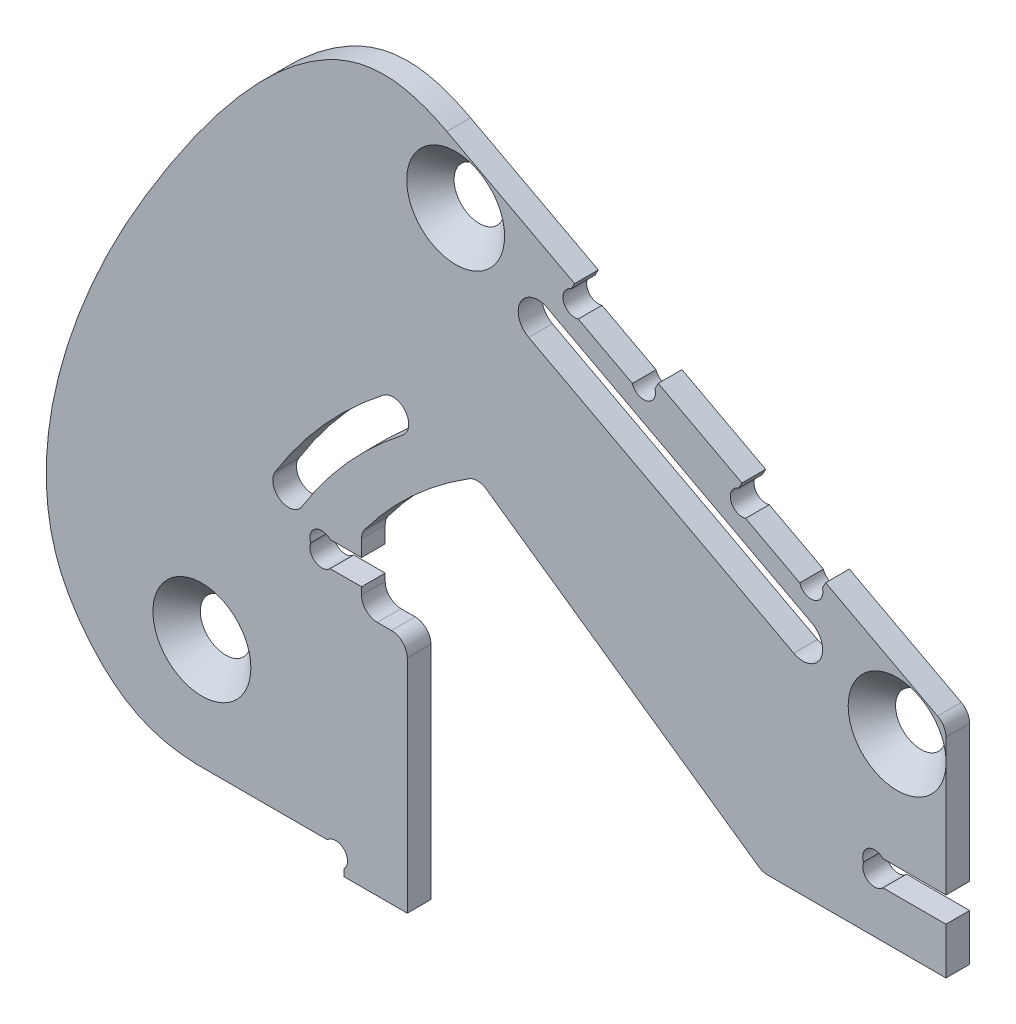
from build123d import *

# Parameters (mm, degrees)
BASE_DEPTH                        = 1.5
CAMERA_CUT_REACH                  = 81.23
TOP_COVER_SOCKETS_REACH           = 81.23
SKETCH4_W                         = 5
SKETCH4_H                         = 1.5
STANDOFF_HOLE_REACH               = 62.831
SKETCH5_R                         = 1.6
GOPRO_MOUNT_HOLDERS_REACH         = 62.831
CAMERA_ANGLE_ADJUSTMENT_CUT_REACH = 62.831
FILLET6_R                         = 1
MILLING_START                     = -1.5
SKETCH10_R                        = 0.75
MILLING_HOLES_DEPTH               = 1.5
GOPRO_STRAP_REACH                 = 62.831
CHAMFER1_SIZE                     = 1.5
FRONT_CURVE_REACH                 = 62.831
FILLET7_R                         = 1


with BuildPart() as part:
    # Sketch1 → Base (new body)
    with BuildSketch(Plane.XY):
        Polygon((2.5, 0), (0, 0), (-1.5, 0), (-1.5, -1.5), (2.5, -1.5), align=None)
        Polygon((-1.5, 0), (0, 0), (2.5, 0), (2.5, 12), (62.584278166, 12), (-6.179064047, 48.562117607), (-32, 0), align=None)
    extrude(amount=BASE_DEPTH)

    # Sketch3 → Camera cut (cut, up to next)
    with BuildSketch(Plane.XY.offset(1.5), mode=Mode.PRIVATE) as camera_cut_sk1:
        with BuildLine():
            Line((2.5, 12), (25, 12))
            Line((25, 12), (6.978655026, 24.6186816))
            ThreePointArc((6.978655026, 24.6186816), (2.93893247, 21.650461355), (-0.396076952, 17.907814978))
            Line((-0.396076952, 17.907814978), (-0.396076952, 13.5))
            Line((-0.396076952, 13.5), (2.5, 13.5))
            Line((2.5, 13.5), (2.5, 12))
        make_face()
    camera_cut_tool1 = extrude(camera_cut_sk1.sketch, amount=-CAMERA_CUT_REACH, mode=Mode.PRIVATE) & part.part
    add(camera_cut_tool1.solids().sort_by_distance((9.594765, 16.626253, 1.5))[0], mode=Mode.SUBTRACT)

    # Sketch4 → Top cover sockets (cut, up to next)
    with BuildSketch(Plane.XY.offset(1.5), mode=Mode.PRIVATE) as top_cover_sockets_sk1:
        Polygon((36.603923048, 16.5), (36.603923048, 15), (36.603923048, 14.95), (36.603923048, 12), (62.584278166, 12), (36.603923048, 25.813999854), (36.603923048, 16.55), align=None)
    top_cover_sockets_tool1 = extrude(top_cover_sockets_sk1.sketch, amount=-TOP_COVER_SOCKETS_REACH, mode=Mode.PRIVATE) & part.part
    # Sketch4 → Top cover sockets (cut, up to next)
    with BuildSketch(Plane.XY.offset(1.5), mode=Mode.PRIVATE) as top_cover_sockets_sk2:
        with Locations((34.103923048, 15.75)):
            Rectangle(SKETCH4_W, SKETCH4_H)
    top_cover_sockets_tool2 = extrude(top_cover_sockets_sk2.sketch, amount=-TOP_COVER_SOCKETS_REACH, mode=Mode.PRIVATE) & part.part
    # Sketch4 → Top cover sockets (cut, up to next)
    with BuildSketch(Plane.XY.offset(1.5), mode=Mode.PRIVATE) as top_cover_sockets_sk3:
        Polygon((36.603923048, 14.95), (36.603923048, 15), (31.603923048, 15), (31.603923048, 16.5), (36.603923048, 16.5), (36.603923048, 16.55), (31.553923048, 16.55), (31.553923048, 14.95), align=None)
    top_cover_sockets_tool3 = extrude(top_cover_sockets_sk3.sketch, amount=-TOP_COVER_SOCKETS_REACH, mode=Mode.PRIVATE) & part.part
    # Sketch4 → Top cover sockets (cut, up to next)
    with BuildSketch(Plane.XY.offset(1.5), mode=Mode.PRIVATE) as top_cover_sockets_sk4:
        Polygon((-0.396076952, 16.55), (-3.446076952, 16.55), (-3.446076952, 14.95), (-0.396076952, 14.95), (-0.396076952, 15), (-3.396076952, 15), (-3.396076952, 16.5), (-0.396076952, 16.5), align=None)
    top_cover_sockets_tool4 = extrude(top_cover_sockets_sk4.sketch, amount=-TOP_COVER_SOCKETS_REACH, mode=Mode.PRIVATE) & part.part
    add(top_cover_sockets_tool1.solids().sort_by_distance((45.264041, 16.604667, 1.5))[0], mode=Mode.SUBTRACT)
    add(top_cover_sockets_tool2.solids().sort_by_distance((34.103923, 15.75, 1.5))[0], mode=Mode.SUBTRACT)
    add(top_cover_sockets_tool3.solids().sort_by_distance((36.550949, 14.975, 1.5))[0], mode=Mode.SUBTRACT)
    add(top_cover_sockets_tool4.solids().sort_by_distance((-1.921077, 16.515558, 1.5))[0], mode=Mode.SUBTRACT)


with BuildPart() as top_cover_sockets_kept_piece:
    # of the separate pieces the step leaves, the one the design keeps (top_cover_sockets_pieces_kept)
    add(part.part.solids().sort_by_distance((-6.179064047, 48.562117607, 0))[0])

    # Sketch5 → Standoff hole (cut, up to next)
    with BuildSketch(Plane.XY.offset(1.5), mode=Mode.PRIVATE) as standoff_hole_sk1:
        with Locations((5.562840845, 38.694611868)):
            Circle(SKETCH5_R)
    standoff_hole_tool1 = extrude(standoff_hole_sk1.sketch, amount=-STANDOFF_HOLE_REACH, mode=Mode.PRIVATE) & top_cover_sockets_kept_piece.part
    # Sketch5 → Standoff hole (cut, up to next)
    with BuildSketch(Plane.XY.offset(1.5), mode=Mode.PRIVATE) as standoff_hole_sk2:
        with Locations((33.513606473, 23.832926162)):
            Circle(SKETCH5_R)
    standoff_hole_tool2 = extrude(standoff_hole_sk2.sketch, amount=-STANDOFF_HOLE_REACH, mode=Mode.PRIVATE) & top_cover_sockets_kept_piece.part
    # Sketch5 → Standoff hole (cut, up to next)
    with BuildSketch(Plane.XY.offset(1.5), mode=Mode.PRIVATE) as standoff_hole_sk3:
        with Locations((-10.5, 7)):
            Circle(SKETCH5_R)
    standoff_hole_tool3 = extrude(standoff_hole_sk3.sketch, amount=-STANDOFF_HOLE_REACH, mode=Mode.PRIVATE) & top_cover_sockets_kept_piece.part
    add(standoff_hole_tool1.solids().sort_by_distance((5.562841, 38.694612, 1.5))[0], mode=Mode.SUBTRACT)
    add(standoff_hole_tool2.solids().sort_by_distance((33.513606, 23.832926, 1.5))[0], mode=Mode.SUBTRACT)
    add(standoff_hole_tool3.solids().sort_by_distance((-10.5, 7, 1.5))[0], mode=Mode.SUBTRACT)

    # Sketch6 → Gopro mount holders (cut, up to next)
    with BuildSketch(Plane.XY.offset(1.5), mode=Mode.PRIVATE) as gopro_mount_holders_sk1:
        Polygon((18.391689882, 35.497616), (13.094004325, 38.314445377), (12.38979698, 36.990023988), (17.687482537, 34.173194611), align=None)
    gopro_mount_holders_tool1 = extrude(gopro_mount_holders_sk1.sketch, amount=-GOPRO_MOUNT_HOLDERS_REACH, mode=Mode.PRIVATE) & top_cover_sockets_kept_piece.part
    # Sketch6 → Gopro mount holders (cut, up to next)
    with BuildSketch(Plane.XY.offset(1.5), mode=Mode.PRIVATE) as gopro_mount_holders_sk2:
        Polygon((28.987060996, 29.863957247), (23.689375439, 32.680786624), (22.985168095, 31.356365234), (28.282853652, 28.539535858), align=None)
    gopro_mount_holders_tool2 = extrude(gopro_mount_holders_sk2.sketch, amount=-GOPRO_MOUNT_HOLDERS_REACH, mode=Mode.PRIVATE) & top_cover_sockets_kept_piece.part
    add(gopro_mount_holders_tool1.solids().sort_by_distance((15.390743, 36.24382, 1.5))[0], mode=Mode.SUBTRACT)
    add(gopro_mount_holders_tool2.solids().sort_by_distance((25.986115, 30.610161, 1.5))[0], mode=Mode.SUBTRACT)

    # Sketch9 → Camera angle adjustment cut (cut, up to next)
    with BuildSketch(Plane.XY, mode=Mode.PRIVATE) as camera_angle_adjustment_cut_sk1:
        with BuildLine():
            ThreePointArc((-5.864731087, 18.513504832), (-5.536990387, 17.137791914), (-4.161277468, 17.465532614))
            ThreePointArc((-4.161277468, 17.465532614), (-1.297808632, 21.300050039), (2.205242111, 24.560665496))
            ThreePointArc((2.205242111, 24.560665496), (2.382581962, 25.963715951), (0.979531507, 26.141055801))
            ThreePointArc((0.979531507, 26.141055801), (-2.786387825, 22.635764075), (-5.864731087, 18.513504832))
        make_face()
    camera_angle_adjustment_cut_tool1 = extrude(camera_angle_adjustment_cut_sk1.sketch, amount=CAMERA_ANGLE_ADJUSTMENT_CUT_REACH, mode=Mode.PRIVATE) & top_cover_sockets_kept_piece.part
    add(camera_angle_adjustment_cut_tool1.solids().sort_by_distance((-1.901224, 21.8415, 0))[0], mode=Mode.SUBTRACT)

    # Fillet6
    fillet6_edges = [top_cover_sockets_kept_piece.edges().sort_by_distance(p)[0] for p in [
        (36.603923048, 25.813999854, 0.75),
    ]]
    fillet(fillet6_edges, radius=FILLET6_R)

    # Sketch10 → Milling holes (cut)
    with BuildSketch(Plane.XY.offset(1.5).offset(MILLING_START)):
        with Locations((-2.915746866, 15.480330086)):
            Circle(SKETCH10_R)
        with Locations((-2.915746866, 16.019669914)):
            Circle(SKETCH10_R)
        with Locations((13.107025547, 37.209302766)):
            Circle(SKETCH10_R)
        with Locations((23.702396662, 31.575644013)):
            Circle(SKETCH10_R)
        with Locations((17.468203759, 34.890423178)):
            Circle(SKETCH10_R)
        with Locations((28.063574873, 29.256764425)):
            Circle(SKETCH10_R)
        with Locations((32.084253134, 16.019669914)):
            Circle(SKETCH10_R)
        with Locations((32.084253134, 15.480330086)):
            Circle(SKETCH10_R)
        with Locations((-2.030330086, -0.530330086)):
            Circle(SKETCH10_R)
    extrude(amount=MILLING_HOLES_DEPTH, mode=Mode.SUBTRACT)

    # Sketch11 → Gopro strap (cut, up to next)
    with BuildSketch(Plane.XY.offset(1.5), mode=Mode.PRIVATE) as gopro_strap_sk1:
        with BuildLine():
            Line((11.36148373, 36.121075278), (28.137487995, 27.201115585))
            ThreePointArc((28.137487995, 27.201115585), (28.654333032, 25.510591641), (26.963809088, 24.993746603))
            Line((26.963809088, 24.993746603), (10.187804823, 33.913706296))
            ThreePointArc((10.187804823, 33.913706296), (9.670959786, 35.604230241), (11.36148373, 36.121075278))
        make_face()
    gopro_strap_tool1 = extrude(gopro_strap_sk1.sketch, amount=-GOPRO_STRAP_REACH, mode=Mode.PRIVATE) & top_cover_sockets_kept_piece.part
    add(gopro_strap_tool1.solids().sort_by_distance((19.162646, 30.557411, 1.5))[0], mode=Mode.SUBTRACT)

    # Chamfer1
    # the kernel refuses this chamfer: 1.5 mm, written as the material it takes off along each edge
    with BuildSketch(Plane(origin=(5.562840845, 38.694611868, 1.5), x_dir=(1, 0, 0), z_dir=(0, -1, 0))) as chamfer1_piece_1:
        Polygon((1.6, -CHAMFER1_SIZE), (1.6 + CHAMFER1_SIZE, 0), (1.6, 0), align=None)
    revolve(axis=Axis((5.562840845, 38.694611868, 1.5), (0, 0, 1)), mode=Mode.SUBTRACT)
    with BuildSketch(Plane(origin=(-10.5, 7, 1.5), x_dir=(1, 0, 0), z_dir=(0, -1, 0))) as chamfer1_piece_2:
        Polygon((1.6, -CHAMFER1_SIZE), (1.6 + CHAMFER1_SIZE, 0), (1.6, 0), align=None)
    revolve(axis=Axis((-10.5, 7, 1.5), (0, 0, 1)), mode=Mode.SUBTRACT)
    with BuildSketch(Plane(origin=(33.513606473, 23.832926162, 1.5), x_dir=(1, 0, 0), z_dir=(0, -1, 0))) as chamfer1_piece_3:
        Polygon((1.6, -CHAMFER1_SIZE), (1.6 + CHAMFER1_SIZE, 0), (1.6, 0), align=None)
    revolve(axis=Axis((33.513606473, 23.832926162, 1.5), (0, 0, 1)), mode=Mode.SUBTRACT)

    # Sketch12 → Front curve (cut, up to next)
    with BuildSketch(Plane.XY.offset(1.5), mode=Mode.PRIVATE) as front_curve_sk1:
        with BuildLine():
            add(Edge.make_bspline(
                [(-10.787702076, 0), (-13.145719201, 0.07852966), (-16.071191812, 0.861478335), (-22.218808251, 9.989827447), (-18.926124359, 21.122538368), (-12.592194116, 32.182950864), (-7.521693168, 39.527230078), (-0.478907967, 44.275086805), (2.453961219, 43.977408771), (5.050339622, 42.591337765)],
                knots=[0.040175263, 0.040175263, 0.040175263, 0.040175263, 0.255853288, 0.322794217, 0.630896498, 0.688624595, 0.842347088, 0.87540616, 1, 1, 1, 1], degree=3))
            Line((5.050339622, 42.591337765), (-6.179064047, 48.562117607))
            Line((-6.179064047, 48.562117607), (-32, 0))
            Line((-32, 0), (-10.787702076, 0))
        make_face()
    front_curve_tool1 = extrude(front_curve_sk1.sketch, amount=-FRONT_CURVE_REACH, mode=Mode.PRIVATE) & top_cover_sockets_kept_piece.part
    add(front_curve_tool1.solids().sort_by_distance((-0.851125, 45.037406, 1.5))[0], mode=Mode.SUBTRACT)

    # Fillet7
    fillet7_edges = [top_cover_sockets_kept_piece.edges().sort_by_distance(p)[0] for p in [
        (-0.396076952, 17.907814978, 0.75),
        (6.978655026, 24.6186816, 0.75),
        (25, 12, 0.75),
        (2.5, 13.5, 0.75),
        (-0.396076952, 13.5, 0.75),
    ]]
    fillet(fillet7_edges, radius=FILLET7_R)


solid = top_cover_sockets_kept_piece.part
